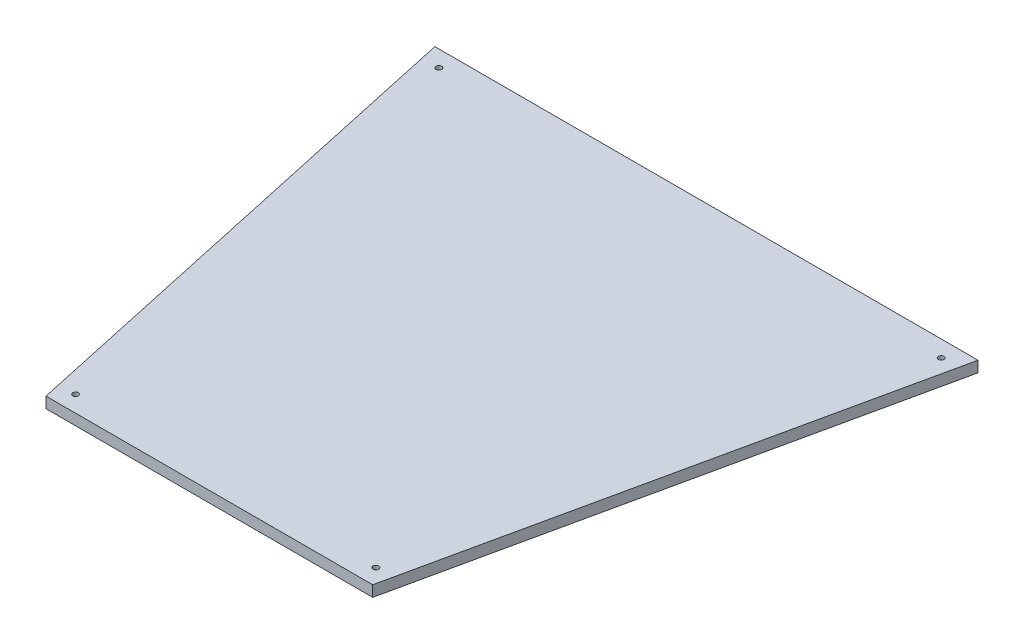
from build123d import *

# Parameters (mm, degrees)
BOSS_EXTRUDE1_DEPTH = 12.7
SKETCH2_R           = 3.2639
CUT_EXTRUDE1_DEPTH  = 695.22623098


with BuildPart() as part:
    # Sketch1 → Boss-Extrude1 (new body)
    with BuildSketch(Plane(origin=(4.555990946, 0, 422.877296058), x_dir=(-0.9999999994755782, 0, 3.2385856298737384e-05), z_dir=(0, -1, 0))):
        Polygon((-184.891194818, -195.663304771), (194.015849766, -195.651033542), (319.509847872, 380.901443857), (-310.422536953, 380.881042958), align=None)
    extrude(amount=BOSS_EXTRUDE1_DEPTH)

    # Sketch2 → Cut-Extrude1 (cut, through all)
    with BuildSketch(Plane(origin=(0, 0, 0), x_dir=(0.9999999994755782, 0, -3.238585631339118e-05), z_dir=(0, 1, 0))):
        with Locations((-174.123876582, -599.47897403)):
            Circle(SKETCH2_R)
        with Locations((174.085046937, -599.490251074)):
            Circle(SKETCH2_R)
        with Locations((291.320912008, -61.045634709)):
            Circle(SKETCH2_R)
        with Locations((-291.324865427, -61.026765227)):
            Circle(SKETCH2_R)
    extrude(amount=-CUT_EXTRUDE1_DEPTH, mode=Mode.SUBTRACT)


solid = part.part
